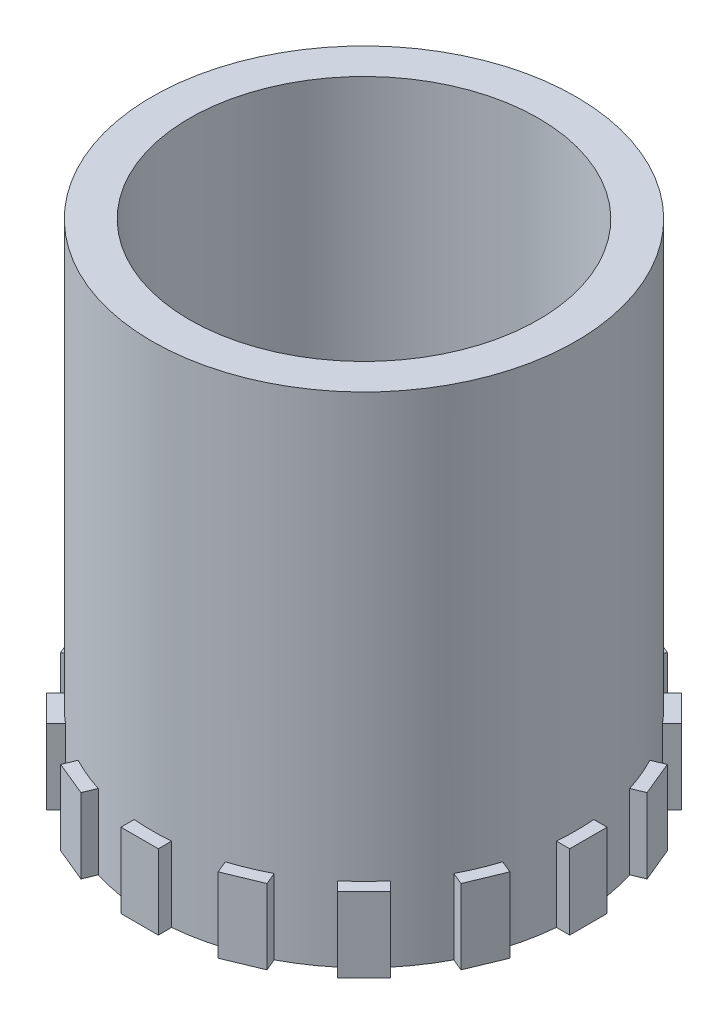
from build123d import *

# Parameters (mm, degrees)
SKETCH_1_R               = 17
SKETCH_1_R_2             = 14
EXTRUDE_1_DEPTH          = 40
SKETCH_2_W               = 3
SKETCH_2_H               = 2
EXTRUDE_2_DEPTH          = 6
PATTERN_CIRCULAR_1_COUNT = 16


with BuildPart() as part:
    # 草图1 → 凸台-拉伸1 (new body)
    with BuildSketch(Plane(origin=(0, 0, 0), x_dir=(1, 0, 0), z_dir=(0, 1, 0))):
        Circle(SKETCH_1_R)
        Circle(SKETCH_1_R_2, mode=Mode.SUBTRACT)
    extrude(amount=EXTRUDE_1_DEPTH)

    # 草图2 → 凸台-拉伸2 (add)
    with BuildSketch(Plane(origin=(0, 0, 0), x_dir=(-1, 0, 0), z_dir=(0, -1, 0))):
        with Locations((0, 17)):
            Rectangle(SKETCH_2_W, SKETCH_2_H)
    extrude_2 = extrude(amount=-EXTRUDE_2_DEPTH)

    # 阵列(圆周)1: 凸台-拉伸2 ×16 about axis
    pattern_circular_1_axis = Axis((0, 40, 0), (0, -1, 0))
    for i in range(1, PATTERN_CIRCULAR_1_COUNT):
        add(extrude_2.rotate(pattern_circular_1_axis, i * 360 / PATTERN_CIRCULAR_1_COUNT))


solid = part.part
